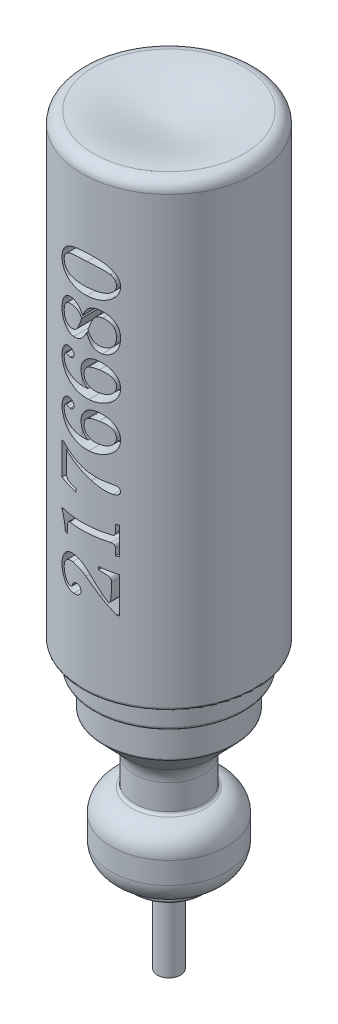
from build123d import *

# Parameters (mm, degrees)
SKETCH2_R          = 1.5
CUT_EXTRUDE1_DEPTH = 12
CUT_EXTRUDE2_DEPTH = 17


with BuildPart() as part:
    # Sketch1 → Revolve1 (revolve)
    with BuildSketch(Plane.XY):
        with BuildLine():
            Line((-15, -2), (-15, -78.95))
            ThreePointArc((-15, -78.95), (-14.853553391, -79.303553391), (-14.5, -79.45))
            Line((-14.5, -79.45), (-13.5, -79.45))
            ThreePointArc((-13.5, -79.45), (-13.146446609, -79.596446609), (-13, -79.95))
            Line((-13, -79.95), (-13, -83.248504981))
            ThreePointArc((-13, -83.248504981), (-12.853553391, -83.602058371), (-12.5, -83.748504981))
            Line((-12.5, -83.748504981), (-11.838067337, -83.748504981))
            ThreePointArc((-11.838067337, -83.748504981), (-11.484513946, -83.89495159), (-11.338067337, -84.248504981))
            Line((-11.338067337, -84.248504981), (-11.338067337, -89.200843352))
            ThreePointArc((-11.338067337, -89.200843352), (-11.329539781, -89.292793537), (-11.304247991, -89.38160728))
            Line((-11.304247991, -89.38160728), (-7.125848206, -93.698489625))
            ThreePointArc((-7.125848206, -93.698489625), (-6.292129508, -94.979875279), (-6, -96.480440643))
            Line((-6, -96.480440643), (-6, -100.813012654))
            ThreePointArc((-6, -100.813012654), (-6.127322004, -101.146345987), (-6.444444444, -101.309916649))
            ThreePointArc((-6.444444444, -101.309916649), (-8.98142397, -102.618481942), (-10, -105.285148609))
            Line((-10, -105.285148609), (-10, -109.057199722))
            ThreePointArc((-10, -109.057199722), (-8.925429803, -111.78517708), (-6.279069767, -113.047452855))
            ThreePointArc((-6.279069767, -113.047452855), (-6.080592765, -113.142123538), (-6, -113.34672184))
            Line((-6, -113.34672184), (-6, -114.253053973))
            ThreePointArc((-6, -114.253053973), (-5.912132034, -114.465186008), (-5.7, -114.553053973))
            Line((-5.7, -114.553053973), (-4, -114.553053973))
            ThreePointArc((-4, -114.553053973), (-2.585786438, -115.138840411), (-2, -116.553053973))
            Line((-2, -116.553053973), (-2, -128.553053973))
            Line((-2, -128.553053973), (0, -128.553053973))
            Line((0, -128.553053973), (0, -2))
            add(Edge.make_bspline(
                [(-13, 0), (-8.615684521, 0), (-5.475926009, -1.591368412), (0, -2)],
                knots=[0, 0, 0, 0, 1, 1, 1, 1], degree=3))
            ThreePointArc((-13, 0), (-14.414213562, -0.585786438), (-15, -2))
        make_face()
    revolve(axis=Axis((0, 0, 0), (0, -1, 0)))

    # Sketch2 → Cut-Extrude1 (cut)
    with BuildSketch(Plane(origin=(0, -128.553053973, 0), x_dir=(-1, 0, 0), z_dir=(0, -1, 0))):
        Circle(SKETCH2_R)
    extrude(amount=-CUT_EXTRUDE1_DEPTH, mode=Mode.SUBTRACT)

    # Sketch3 → Cut-Extrude2 (cut)
    # profile 1 of 7: a face of its own
    with BuildSketch(Plane.XY.offset(28.084540548)):
        with BuildLine():
            add(Edge.make_bspline(
                [(4.012275052, -64.439285096), (4.027570925, -64.449402774), (4.056027274, -64.46822564), (4.111563837, -64.463552169), (4.155281304, -64.421935656), (4.191774704, -64.356753871), (4.227737408, -64.265034063), (4.257767019, -64.143651596), (4.28793338, -63.994021196), (4.312480378, -63.815251868), (4.337267438, -63.608340074), (4.355852957, -63.372364936), (4.37457101, -63.107336018), (4.388121605, -62.813443848), (4.397351263, -62.490865696), (4.406076371, -62.139647537), (4.409247983, -61.759001657), (4.410344043, -61.495241123), (4.410912873, -61.358355609)],
                knots=[0, 0, 0, 0, 0.264522454, 0.492115977, 0.758469058, 1.116905389, 1.594696211, 2.206856012, 2.960861016, 3.847548454, 4.869807865, 6.037241621, 7.341541194, 8.792334255, 10.380264796, 12.105895113, 13.979051144, 16, 16, 16, 16], degree=3))
            add(Edge.make_bspline(
                [(4.410912873, -61.358355609), (4.407536595, -61.279311099), (4.401219546, -61.131418066), (4.353176689, -60.926011204), (4.265371743, -60.757206199), (4.158702197, -60.644311595), (4.046066527, -60.570403426), (3.929640244, -60.516219647), (3.785571421, -60.456005246), (3.610541877, -60.393922589), (3.404695577, -60.333468809), (3.168763866, -60.269396084), (2.903431422, -60.200644777), (2.715004696, -60.158523173), (2.616041078, -60.136400481)],
                knots=[0, 0, 0, 0, 1.181004775, 2.209671203, 3.12485452, 3.993073648, 4.496817558, 5.130576657, 5.908980013, 6.830669454, 7.904106987, 9.114595617, 10.484556503, 12, 12, 12, 12], degree=3))
            Line((2.616041078, -60.136400481), (2.616041078, -59.623579968))
            Line((2.616041078, -59.623579968), (5.436553898, -59.863964584))
            Line((5.436553898, -59.863964584), (5.436553898, -66.033836378))
            Line((5.436553898, -66.033836378), (5.089999411, -66.033836378))
            Line((5.089999411, -66.033836378), (2.856425693, -64.004589584))
            add(Edge.make_bspline(
                [(2.856425693, -64.004589584), (2.714937324, -63.87029897), (2.446338456, -63.615364188), (2.063553437, -63.254259749), (1.72219614, -62.935817451), (1.420088146, -62.661834286), (1.163659536, -62.425778824), (0.943658337, -62.236791775), (0.769724861, -62.084128105), (0.66260023, -62.002287756), (0.61684236, -61.967329968)],
                knots=[0, 0, 0, 0, 1.545890058, 2.934688704, 4.17028174, 5.24526459, 6.166829156, 6.931941195, 7.543782827, 8, 8, 8, 8], degree=3))
            add(Edge.make_bspline(
                [(0.61684236, -61.967329968), (0.509601135, -61.890499262), (0.301234745, -61.741219571), (-0.01769409, -61.54645817), (-0.331496341, -61.3844805), (-0.639571219, -61.256730589), (-0.937812972, -61.158317188), (-1.222967196, -61.087569923), (-1.494446189, -61.042662567), (-1.671330002, -61.036715317), (-1.756955717, -61.033836378)],
                knots=[0, 0, 0, 0, 1.221342228, 2.373030247, 3.457097868, 4.48831189, 5.458191672, 6.362523757, 7.207332364, 8, 8, 8, 8], degree=3))
            add(Edge.make_bspline(
                [(-1.756955717, -61.033836378), (-1.82444218, -61.035644607), (-1.955706719, -61.0391617), (-2.147497713, -61.05868324), (-2.328269631, -61.09395155), (-2.497048024, -61.147650494), (-2.656799828, -61.21009949), (-2.803673067, -61.291879334), (-2.940568281, -61.385659523), (-3.065475101, -61.494676852), (-3.177006903, -61.616227469), (-3.274854171, -61.749414063), (-3.353841749, -61.8954215), (-3.423588378, -62.049918173), (-3.475401879, -62.217481251), (-3.510426031, -62.396176839), (-3.533164571, -62.585742824), (-3.536229705, -62.715793149), (-3.537805076, -62.782634455)],
                knots=[0, 0, 0, 0, 1.144458313, 2.226028525, 3.265224511, 4.260822943, 5.225886888, 6.168369967, 7.104301311, 8.035219743, 8.972793312, 9.896800599, 10.829370084, 11.782403676, 12.767191675, 13.795287537, 14.866855124, 16, 16, 16, 16], degree=3))
            add(Edge.make_bspline(
                [(-3.537805076, -62.782634455), (-3.537153037, -62.858169793), (-3.535874806, -63.00624613), (-3.511165482, -63.221940592), (-3.481844074, -63.428229049), (-3.43177894, -63.622382291), (-3.373976788, -63.808012996), (-3.295390881, -63.979812413), (-3.210499703, -64.14452535), (-3.108932266, -64.294596265), (-2.998475464, -64.428953542), (-2.88979471, -64.550456448), (-2.776515816, -64.652275226), (-2.660686823, -64.73343128), (-2.544857462, -64.800104452), (-2.426257483, -64.846799056), (-2.30496014, -64.873009304), (-2.223815576, -64.877678408), (-2.183638409, -64.879990225)],
                knots=[0, 0, 0, 0, 1.325942456, 2.599322467, 3.810399692, 4.982506719, 6.117580095, 7.22043751, 8.296137669, 9.369725283, 10.395602926, 11.350345251, 12.230945344, 13.064096537, 13.830856947, 14.573645874, 15.293768247, 16, 16, 16, 16], degree=3))
            add(Edge.make_bspline(
                [(-2.183638409, -64.879990225), (-2.133270986, -64.878119323), (-2.041272429, -64.874702029), (-1.965515875, -64.823177754), (-1.931234563, -64.799862019)],
                knots=[0, 0, 0, 0, 1.094961168, 2, 2, 2, 2], degree=3))
            add(Edge.make_bspline(
                [(-1.931234563, -64.799862019), (-1.916527465, -64.784352716), (-1.883229775, -64.749238788), (-1.845176649, -64.677284016), (-1.809554861, -64.585447304), (-1.788520209, -64.516919949), (-1.776987768, -64.479349199)],
                knots=[0, 0, 0, 0, 0.710690112, 1.609041988, 2.689135369, 4, 4, 4, 4], degree=3))
            add(Edge.make_bspline(
                [(-1.776987768, -64.479349199), (-1.76309423, -64.430088211), (-1.736291928, -64.335057855), (-1.674081365, -64.206364611), (-1.596534231, -64.0968405), (-1.503739354, -64.008174739), (-1.396525414, -63.938164076), (-1.275281532, -63.887474524), (-1.137837547, -63.860039999), (-1.041929214, -63.856304393), (-0.991731358, -63.854349199)],
                knots=[0, 0, 0, 0, 1.118841646, 2.158379759, 3.111706183, 4.042232496, 4.950445241, 5.900628329, 6.901201232, 8, 8, 8, 8], degree=3))
            add(Edge.make_bspline(
                [(-0.991731358, -63.854349199), (-0.937312151, -63.856788057), (-0.831405389, -63.861534389), (-0.680783163, -63.905992689), (-0.542575809, -63.97370669), (-0.426023596, -64.07394894), (-0.325612078, -64.191302102), (-0.255702225, -64.330213888), (-0.21160543, -64.48402796), (-0.20690226, -64.591881538), (-0.204471743, -64.64761843)],
                knots=[0, 0, 0, 0, 1.041658564, 2.02720126, 2.989825143, 3.972448695, 4.955072247, 5.934935497, 6.932809853, 8, 8, 8, 8], degree=3))
            add(Edge.make_bspline(
                [(-0.204471743, -64.64761843), (-0.209235613, -64.71235378), (-0.218800366, -64.842327409), (-0.293330186, -65.028929621), (-0.414571215, -65.201120646), (-0.578221458, -65.357019), (-0.778843416, -65.489376781), (-1.014463687, -65.581095001), (-1.275848652, -65.641109719), (-1.460790424, -65.646452259), (-1.556635204, -65.649220994)],
                knots=[0, 0, 0, 0, 0.832009653, 1.670483162, 2.54834122, 3.527553162, 4.565144606, 5.62233063, 6.767789471, 8, 8, 8, 8], degree=3))
            add(Edge.make_bspline(
                [(-1.556635204, -65.649220994), (-1.667128572, -65.64504904), (-1.885471449, -65.636804959), (-2.205262687, -65.569136172), (-2.507966241, -65.455048278), (-2.795417591, -65.300335292), (-3.061821176, -65.098555916), (-3.301206114, -64.848166207), (-3.516719493, -64.554360558), (-3.704008428, -64.221388714), (-3.8574367, -63.85856231), (-3.97013616, -63.477159089), (-4.038248064, -63.080879158), (-4.04646881, -62.812280257), (-4.050625589, -62.676464584)],
                knots=[0, 0, 0, 0, 0.920351443, 1.818680946, 2.709792191, 3.608811046, 4.530474131, 5.482977408, 6.485916793, 7.560064738, 8.659916092, 9.762341353, 10.868539243, 12, 12, 12, 12], degree=3))
            add(Edge.make_bspline(
                [(-4.050625589, -62.676464584), (-4.046605065, -62.541947686), (-4.038673863, -62.276589101), (-3.969132107, -61.887053942), (-3.862535929, -61.511535878), (-3.707752726, -61.157362274), (-3.519538451, -60.831466189), (-3.303912189, -60.54108852), (-3.056043464, -60.298225786), (-2.784430343, -60.097997117), (-2.491125237, -59.944246462), (-2.183351613, -59.832636696), (-1.862127934, -59.764167939), (-1.643103793, -59.755937636), (-1.532596743, -59.751785096)],
                knots=[0, 0, 0, 0, 1.125398848, 2.220050047, 3.302844793, 4.387096258, 5.446679886, 6.448527043, 7.405228046, 8.341154212, 9.26394752, 10.167643655, 11.07549783, 12, 12, 12, 12], degree=3))
            add(Edge.make_bspline(
                [(-1.532596743, -59.751785096), (-1.454384005, -59.754499778), (-1.296672679, -59.759973773), (-1.059615858, -59.792103676), (-0.821983493, -59.849432536), (-0.584433056, -59.927773085), (-0.348769818, -60.025003705), (-0.118934933, -60.144275983), (0.103005668, -60.283572508), (0.242400599, -60.39098813), (0.31235518, -60.444894071)],
                knots=[0, 0, 0, 0, 0.935079848, 1.885532828, 2.853519397, 3.853043441, 4.872853088, 5.897399395, 6.944821426, 8, 8, 8, 8], degree=3))
            add(Edge.make_bspline(
                [(0.31235518, -60.444894071), (0.429592312, -60.54184648), (0.659358005, -60.731857417), (0.980445438, -61.032644881), (1.277482345, -61.335386603), (1.459229319, -61.545708005), (1.548332745, -61.648820353)],
                knots=[0, 0, 0, 0, 1.056246566, 2.070071318, 3.053831537, 4, 4, 4, 4], degree=3))
            Line((1.548332745, -61.648820353), (3.04673018, -63.445695353))
            add(Edge.make_bspline(
                [(3.04673018, -63.445695353), (3.136750787, -63.551896236), (3.306828424, -63.752543576), (3.558152222, -64.024435849), (3.788108509, -64.252188782), (3.941353667, -64.38009192), (4.012275052, -64.439285096)],
                knots=[0, 0, 0, 0, 1.203835763, 2.274429704, 3.201411408, 4, 4, 4, 4], degree=3))
        make_face()
    # profile 2 of 7: a face of its own
    with BuildSketch(Plane.XY.offset(28.084540548)):
        with BuildLine():
            Line((-4.050625589, -54.238964584), (4.485031463, -54.238964584))
            add(Edge.make_bspline(
                [(4.485031463, -54.238964584), (4.515299452, -54.23762475), (4.573546643, -54.235046398), (4.654350966, -54.209899518), (4.7268282, -54.172368929), (4.761847982, -54.132740611), (4.779502616, -54.11276266)],
                knots=[0, 0, 0, 0, 1.091998458, 2.101422775, 3.042864219, 4, 4, 4, 4], degree=3))
            add(Edge.make_bspline(
                [(4.779502616, -54.11276266), (4.802340249, -54.081540527), (4.847895106, -54.019260873), (4.890659574, -53.909049942), (4.920515814, -53.791196681), (4.92264658, -53.70831965), (4.923733386, -53.666047917)],
                knots=[0, 0, 0, 0, 0.966155666, 1.927217458, 2.942769681, 4, 4, 4, 4], degree=3))
            Line((4.923733386, -53.666047917), (4.923733386, -52.444092789))
            Line((4.923733386, -52.444092789), (5.436553898, -52.444092789))
            Line((5.436553898, -52.444092789), (5.436553898, -57.187682532))
            Line((5.436553898, -57.187682532), (4.923733386, -57.187682532))
            Line((4.923733386, -57.187682532), (4.923733386, -56.075903686))
            add(Edge.make_bspline(
                [(4.923733386, -56.075903686), (4.92225437, -56.021621282), (4.919466721, -55.919309753), (4.8872702, -55.776571171), (4.834193156, -55.65463421), (4.754826373, -55.558957775), (4.661845701, -55.482967958), (4.551940077, -55.430367063), (4.428185008, -55.397380472), (4.340355106, -55.39437309), (4.294726975, -55.392810737)],
                knots=[0, 0, 0, 0, 1.230543622, 2.319329815, 3.303175984, 4.21963065, 5.114763596, 6.009896541, 6.966130023, 8, 8, 8, 8], degree=3))
            Line((4.294726975, -55.392810737), (-2.287805076, -55.392810737))
            add(Edge.make_bspline(
                [(-2.287805076, -55.392810737), (-2.320722749, -55.394759542), (-2.3844991, -55.398535252), (-2.47700585, -55.427738579), (-2.559232212, -55.479538614), (-2.633110148, -55.547053573), (-2.693712853, -55.630145027), (-2.738034493, -55.725253773), (-2.765008093, -55.832051422), (-2.767353818, -55.906802231), (-2.768574307, -55.945695353)],
                knots=[0, 0, 0, 0, 0.965456179, 1.870523259, 2.811798899, 3.796757234, 4.792577982, 5.809775624, 6.860418164, 8, 8, 8, 8], degree=3))
            Line((-2.768574307, -55.945695353), (-2.768574307, -57.444092789))
            Line((-2.768574307, -57.444092789), (-3.28139482, -57.444092789))
            add(Edge.make_bspline(
                [(-3.28139482, -57.444092789), (-3.299592202, -57.275679367), (-3.334326796, -56.954217094), (-3.401994502, -56.498410872), (-3.478774544, -56.092345633), (-3.568341042, -55.732255233), (-3.667138724, -55.406252802), (-3.780138498, -55.104842548), (-3.903999872, -54.821728769), (-4.002487854, -54.645575444), (-4.050625589, -54.559477404)],
                knots=[0, 0, 0, 0, 1.351220085, 2.579166639, 3.675057167, 4.646601121, 5.537965881, 6.390857449, 7.213503243, 8, 8, 8, 8], degree=3))
            Line((-4.050625589, -54.559477404), (-4.050625589, -54.238964584))
        make_face()
    # profile 3 of 7: a face of its own
    with BuildSketch(Plane.XY.offset(28.084540548)):
        with BuildLine():
            add(Edge.make_bspline(
                [(-4.050625589, -49.751785096), (-4.050625589, -49.521416507), (-4.050625589, -49.043318216), (-4.050625589, -48.565219925), (-4.050625589, -48.317490225)],
                knots=[0, 0, 0, 0, 0.963687151, 2, 2, 2, 2], degree=3))
            Line((-4.050625589, -48.317490225), (-4.050625589, -44.110759455))
            Line((-4.050625589, -44.110759455), (-3.738125589, -44.110759455))
            add(Edge.make_bspline(
                [(-3.738125589, -44.110759455), (-3.603984731, -44.187009043), (-3.342248579, -44.335787528), (-2.957473025, -44.551663442), (-2.586645697, -44.749070504), (-2.233128765, -44.933499416), (-1.895286821, -45.102635755), (-1.573162073, -45.256409699), (-1.267237158, -45.397388525), (-0.88301847, -45.561274042), (-0.417643172, -45.742137924), (0.128996677, -45.935022341), (0.664326902, -46.098209719), (1.196040999, -46.235340378), (1.744054038, -46.347796207), (2.326158886, -46.43324348), (2.949307385, -46.505352032), (3.379759261, -46.532608608), (3.601618001, -46.546656891)],
                knots=[0, 0, 0, 0, 0.947153305, 1.848089124, 2.708124796, 3.52577056, 4.295656057, 5.027159827, 5.716802481, 6.363187097, 7.590941, 8.780963107, 9.920686199, 11.025171827, 12.150572577, 13.352842426, 14.635631354, 16, 16, 16, 16], degree=3))
            add(Edge.make_bspline(
                [(3.601618001, -46.546656891), (3.691770658, -46.551863461), (3.862761409, -46.561738659), (4.105815902, -46.577860049), (4.321531736, -46.593564699), (4.510489383, -46.609752823), (4.672214323, -46.624905279), (4.806849702, -46.642199433), (4.914975489, -46.653876523), (5.020155825, -46.67561991), (5.128866133, -46.704613913), (5.242357509, -46.756855858), (5.340558978, -46.825760281), (5.421514783, -46.911369856), (5.486070803, -47.010357313), (5.533793782, -47.123328348), (5.558306358, -47.250748663), (5.562556632, -47.339836531), (5.564759027, -47.38599984)],
                knots=[0, 0, 0, 0, 1.80468871, 3.422917174, 4.868088381, 6.127020532, 7.213196683, 8.113639518, 8.840280135, 9.384637349, 10.258992284, 11.082909861, 11.867865964, 12.641855903, 13.422831762, 14.218379112, 15.076804522, 16, 16, 16, 16], degree=3))
            add(Edge.make_bspline(
                [(5.564759027, -47.38599984), (5.562626547, -47.438479337), (5.558547929, -47.538852559), (5.511640695, -47.679736481), (5.438527984, -47.803467744), (5.333459571, -47.907848529), (5.196013996, -47.98931307), (5.026336517, -48.046331866), (4.824133456, -48.078790445), (4.678800085, -48.082916066), (4.60121736, -48.08511843)],
                knots=[0, 0, 0, 0, 0.928757684, 1.77635853, 2.606183773, 3.461548056, 4.376805525, 5.419496668, 6.622460364, 8, 8, 8, 8], degree=3))
            add(Edge.make_bspline(
                [(4.60121736, -48.08511843), (4.523033319, -48.082763659), (4.356227798, -48.07773976), (4.092579297, -48.048421359), (3.800760308, -47.998672843), (3.537986106, -47.944636909), (3.307405044, -47.882961079), (3.109539171, -47.828326433), (2.892139292, -47.756846688), (2.654561327, -47.671714078), (2.394732486, -47.578886913), (2.115001107, -47.471776398), (1.815392123, -47.351665333), (1.609005695, -47.266029414), (1.502259027, -47.221737019)],
                knots=[0, 0, 0, 0, 0.869827789, 1.855776124, 2.947437975, 4.16239747, 4.837986701, 5.602168407, 6.445427082, 7.382753648, 8.40951659, 9.514464775, 10.714437733, 12, 12, 12, 12], degree=3))
            add(Edge.make_bspline(
                [(1.502259027, -47.221737019), (1.357882604, -47.161986249), (1.077238642, -47.045840602), (0.66970255, -46.870463091), (0.285379116, -46.703008886), (-0.075592119, -46.540100754), (-0.413456004, -46.385192136), (-0.726787452, -46.233827003), (-1.017187437, -46.090711346), (-1.201579418, -45.994124034), (-1.290208922, -45.947698558)],
                knots=[0, 0, 0, 0, 1.221323737, 2.374051984, 3.467872604, 4.498092631, 5.469575672, 6.373002728, 7.217970541, 8, 8, 8, 8], degree=3))
            Line((-1.290208922, -45.947698558), (-3.024984563, -45.018211378))
            Line((-3.024984563, -45.018211378), (-3.024984563, -48.672057532))
            add(Edge.make_bspline(
                [(-3.024984563, -48.672057532), (-3.021693391, -48.735862721), (-3.015478534, -48.856348684), (-2.964091757, -49.025996755), (-2.876548743, -49.169265347), (-2.771212315, -49.26913126), (-2.655566186, -49.333531841), (-2.534884958, -49.386879611), (-2.379411608, -49.442430689), (-2.189866945, -49.499142723), (-1.966204644, -49.559757368), (-1.70849137, -49.620117531), (-1.417114652, -49.687570707), (-1.210859113, -49.729589358), (-1.10190764, -49.751785096)],
                knots=[0, 0, 0, 0, 0.951014373, 1.795839581, 2.614573855, 3.432519222, 3.928224, 4.583941917, 5.400489657, 6.39039533, 7.536318261, 8.858539916, 10.340569627, 12, 12, 12, 12], degree=3))
            Line((-1.10190764, -49.751785096), (-1.10190764, -50.264605609))
            Line((-1.10190764, -50.264605609), (-4.050625589, -49.751785096))
        make_face()
    # profile 4 of 7: a face of its own
    with BuildSketch(Plane.XY.offset(28.084540548)):
        with BuildLine():
            add(Edge.make_bspline(
                [(0.955384027, -41.418451763), (0.857291868, -41.334336714), (0.667628078, -41.171698036), (0.423964571, -40.902785561), (0.216819804, -40.632806086), (0.059646402, -40.349599032), (-0.06121418, -40.057966185), (-0.141094702, -39.752374058), (-0.196968784, -39.434648479), (-0.201944912, -39.217180995), (-0.204471743, -39.106753045)],
                knots=[0, 0, 0, 0, 1.154902062, 2.233033763, 3.240199197, 4.19234298, 5.121957947, 6.056645336, 7.013182717, 8, 8, 8, 8], degree=3))
            add(Edge.make_bspline(
                [(-0.204471743, -39.106753045), (-0.202035846, -39.01784451), (-0.197237445, -38.842706209), (-0.163120231, -38.585542316), (-0.104615575, -38.340165096), (-0.024362616, -38.105564192), (0.080553665, -37.88200006), (0.209208286, -37.66948897), (0.360261828, -37.468230475), (0.53234734, -37.280770545), (0.721391714, -37.108773232), (0.925662672, -36.958689484), (1.142322237, -36.830889803), (1.370591928, -36.726778996), (1.61174009, -36.64617878), (1.8645531, -36.588071245), (2.130326213, -36.553794213), (2.311454307, -36.549065291), (2.403701334, -36.546656891)],
                knots=[0, 0, 0, 0, 1.044483906, 2.057498042, 3.041291563, 4.003930521, 4.965577941, 5.937000168, 6.91766058, 7.91718785, 8.922517361, 9.915774843, 10.889917702, 11.872928882, 12.857847881, 13.872197807, 14.916328091, 16, 16, 16, 16], degree=3))
            add(Edge.make_bspline(
                [(2.403701334, -36.546656891), (2.514682404, -36.549247878), (2.732792559, -36.554339924), (3.052743959, -36.597532397), (3.358698126, -36.667381056), (3.650385781, -36.765257758), (3.926114818, -36.893085392), (4.189131072, -37.045437167), (4.435839234, -37.229470135), (4.666617981, -37.438111091), (4.875185929, -37.667889726), (5.061981045, -37.909975193), (5.216164973, -38.169168933), (5.345651161, -38.439407201), (5.444019998, -38.724565374), (5.513895483, -39.02254087), (5.556990177, -39.333858853), (5.562143791, -39.54598382), (5.564759027, -39.653628045)],
                knots=[0, 0, 0, 0, 1.075461414, 2.113595198, 3.12322715, 4.11394509, 5.090006378, 6.064736038, 7.055115589, 8.067896563, 9.075887968, 10.059794727, 11.02669112, 11.993760831, 12.959985324, 13.94440296, 14.956873611, 16, 16, 16, 16], degree=3))
            add(Edge.make_bspline(
                [(5.564759027, -39.653628045), (5.563044639, -39.729795639), (5.559638877, -39.881108356), (5.537779657, -40.10483831), (5.499574458, -40.322472923), (5.445476722, -40.533511604), (5.375147706, -40.737529223), (5.290388052, -40.935864505), (5.190279807, -41.1271541), (5.076342695, -41.313335889), (4.942428092, -41.489446429), (4.795038681, -41.65993012), (4.629139856, -41.821760005), (4.444446544, -41.972958815), (4.24358887, -42.117217854), (4.02694634, -42.254467105), (3.790750981, -42.379615079), (3.54080438, -42.499567193), (3.276104784, -42.607708321), (2.999466399, -42.70240447), (2.711305464, -42.779377623), (2.412387849, -42.843673202), (2.103757053, -42.896000386), (1.783439962, -42.932088175), (1.452419601, -42.951402976), (1.227843093, -42.955055733), (1.113637232, -42.956913302)],
                knots=[0, 0, 0, 0, 0.883685917, 1.755509281, 2.60501919, 3.44490211, 4.280307152, 5.106284122, 5.944808297, 6.783225109, 7.635380099, 8.508441654, 9.395922559, 10.320367182, 11.27496185, 12.263651042, 13.293080668, 14.374205368, 15.479050434, 16.608419863, 17.764157401, 18.93718706, 20.154726882, 21.394346088, 22.674923956, 24, 24, 24, 24], degree=3))
            add(Edge.make_bspline(
                [(1.113637232, -42.956913302), (0.990043038, -42.955775257), (0.745194116, -42.953520711), (0.382980666, -42.923394568), (0.029123491, -42.880423645), (-0.3159355, -42.818018711), (-0.652465557, -42.73829117), (-0.980135671, -42.639687465), (-1.299180811, -42.523342318), (-1.607558485, -42.390253991), (-1.901197282, -42.24191177), (-2.178381668, -42.083953518), (-2.436276006, -41.915698837), (-2.676922529, -41.739925013), (-2.894556924, -41.550282453), (-3.097090172, -41.353927375), (-3.278520674, -41.145678786), (-3.4419905, -40.929200053), (-3.58215657, -40.705015694), (-3.708108049, -40.479742236), (-3.814896981, -40.251140081), (-3.900784784, -40.019166991), (-3.967069928, -39.785274685), (-4.016048349, -39.549797894), (-4.044277273, -39.311102469), (-4.048507818, -39.150894143), (-4.050625589, -39.070695353)],
                knots=[0, 0, 0, 0, 1.243143806, 2.462756642, 3.654348452, 4.828483941, 5.988679225, 7.132142967, 8.269174644, 9.40360339, 10.509240407, 11.577506956, 12.611683861, 13.605989218, 14.572956063, 15.513589683, 16.441980262, 17.348927284, 18.239807545, 19.099832649, 19.94442161, 20.775543684, 21.585767516, 22.388154802, 23.193125368, 24, 24, 24, 24], degree=3))
            add(Edge.make_bspline(
                [(-4.050625589, -39.070695353), (-4.04935796, -38.989148388), (-4.04686783, -38.82895754), (-4.019151669, -38.5934099), (-3.978652412, -38.36725582), (-3.917759772, -38.150790302), (-3.839026351, -37.94411597), (-3.74550704, -37.746010917), (-3.634731556, -37.557105934), (-3.547621121, -37.4406453), (-3.503750589, -37.38199343)],
                knots=[0, 0, 0, 0, 1.081133678, 2.12377886, 3.141755168, 4.125997766, 5.101473931, 6.072112995, 7.02907811, 8, 8, 8, 8], degree=3))
            add(Edge.make_bspline(
                [(-3.503750589, -37.38199343), (-3.466739819, -37.335639509), (-3.394920383, -37.24568968), (-3.272527311, -37.129791997), (-3.148578519, -37.02805553), (-3.017975778, -36.944620644), (-2.87969083, -36.882976767), (-2.737179038, -36.835304765), (-2.587842275, -36.809888931), (-2.486871631, -36.805351383), (-2.436042255, -36.803067148)],
                knots=[0, 0, 0, 0, 1.127905394, 2.18870153, 3.201176125, 4.178074235, 5.128053522, 6.076756242, 7.031824741, 8, 8, 8, 8], degree=3))
            add(Edge.make_bspline(
                [(-2.436042255, -36.803067148), (-2.369651375, -36.805339722), (-2.241282837, -36.809733804), (-2.058293947, -36.855534202), (-1.89335545, -36.927459398), (-1.750618264, -37.028037058), (-1.634672076, -37.149670138), (-1.547885842, -37.285886927), (-1.494589871, -37.436962961), (-1.48924855, -37.542489284), (-1.486523025, -37.596336378)],
                knots=[0, 0, 0, 0, 1.153726211, 2.230760421, 3.261177434, 4.270660677, 5.249146575, 6.168386457, 7.065379467, 8, 8, 8, 8], degree=3))
            add(Edge.make_bspline(
                [(-1.486523025, -37.596336378), (-1.489109143, -37.646062894), (-1.494204648, -37.744040492), (-1.538092876, -37.884773307), (-1.609564322, -38.013796572), (-1.708367818, -38.125892342), (-1.822137741, -38.222061263), (-1.951409366, -38.292252753), (-2.0917139, -38.333123627), (-2.188721662, -38.338707835), (-2.237724948, -38.341528686)],
                knots=[0, 0, 0, 0, 1.015196891, 2.000271924, 2.984589206, 4.011205994, 5.0394568, 6.017214113, 6.99839949, 8, 8, 8, 8], degree=3))
            add(Edge.make_bspline(
                [(-2.237724948, -38.341528686), (-2.31013673, -38.338320504), (-2.465818627, -38.331423063), (-2.617390406, -38.294937875), (-2.698462127, -38.275422917)],
                knots=[0, 0, 0, 0, 0.93025309, 2, 2, 2, 2], degree=3))
            add(Edge.make_bspline(
                [(-2.698462127, -38.275422917), (-2.735723121, -38.265462905), (-2.805143136, -38.24690666), (-2.905172975, -38.229688326), (-2.991908128, -38.216178713), (-3.046311835, -38.214216228), (-3.071058281, -38.213323558)],
                knots=[0, 0, 0, 0, 1.221632649, 2.275992896, 3.215806202, 4, 4, 4, 4], degree=3))
            add(Edge.make_bspline(
                [(-3.071058281, -38.213323558), (-3.101490295, -38.2148212), (-3.161754619, -38.21778697), (-3.24548095, -38.254770874), (-3.321574412, -38.311147276), (-3.360734459, -38.362370985), (-3.381555076, -38.389605609)],
                knots=[0, 0, 0, 0, 0.975009045, 1.930804205, 2.899849836, 4, 4, 4, 4], degree=3))
            add(Edge.make_bspline(
                [(-3.381555076, -38.389605609), (-3.405964794, -38.431573939), (-3.456898037, -38.519144932), (-3.502259548, -38.673702886), (-3.532992796, -38.847751998), (-3.536150765, -38.971706811), (-3.537805076, -39.036640866)],
                knots=[0, 0, 0, 0, 0.861132824, 1.796837179, 2.845867366, 4, 4, 4, 4], degree=3))
            add(Edge.make_bspline(
                [(-3.537805076, -39.036640866), (-3.533747014, -39.140669997), (-3.525725688, -39.34629811), (-3.444093787, -39.645665721), (-3.319458382, -39.931569957), (-3.173364911, -40.154699308), (-3.031571655, -40.325539906), (-2.901494966, -40.446185974), (-2.75728583, -40.566282072), (-2.591921068, -40.67664953), (-2.411071721, -40.785530612), (-2.212615696, -40.889628291), (-1.995757446, -40.987519607), (-1.680146572, -41.111084958), (-1.258579848, -41.24406022), (-0.724070052, -41.357248348), (-0.159588071, -41.427132726), (0.226677, -41.434638904), (0.424534668, -41.438483814)],
                knots=[0, 0, 0, 0, 0.971587853, 1.920479144, 2.883101285, 3.881572642, 4.404900302, 4.95745184, 5.53920268, 6.159773275, 6.815714157, 7.514581237, 8.25575938, 9.041447137, 10.685960995, 12.386095444, 14.148839282, 16, 16, 16, 16], degree=3))
            add(Edge.make_bspline(
                [(0.424534668, -41.438483814), (0.457923825, -41.437910889), (0.531394208, -41.43665021), (0.652919265, -41.432284942), (0.796487652, -41.426344967), (0.89996568, -41.421204679), (0.955384027, -41.418451763)],
                knots=[0, 0, 0, 0, 0.754292582, 1.659765325, 2.74667174, 4, 4, 4, 4], degree=3))
        make_face()
        with BuildLine():
            add(Edge.make_bspline(
                [(0.30834877, -39.453307532), (0.310328133, -39.518856559), (0.314224517, -39.647890073), (0.343395876, -39.837064816), (0.387942189, -40.017788211), (0.455976975, -40.188800817), (0.541574895, -40.349834852), (0.645199921, -40.502731573), (0.768620915, -40.645388523), (0.909856976, -40.778732944), (1.068563874, -40.899719208), (1.244650651, -41.003625783), (1.434519268, -41.094360735), (1.640992072, -41.166171208), (1.861586738, -41.221902459), (2.097371473, -41.261645648), (2.348433161, -41.285986671), (2.52116561, -41.28879951), (2.610031463, -41.290246635)],
                knots=[0, 0, 0, 0, 0.948882356, 1.867878613, 2.766138513, 3.638843228, 4.525631163, 5.402664559, 6.307820492, 7.251812306, 8.211083479, 9.191183553, 10.2076731, 11.253632215, 12.351239893, 13.499028375, 14.71332239, 16, 16, 16, 16], degree=3))
            add(Edge.make_bspline(
                [(2.610031463, -41.290246635), (2.706245663, -41.288859533), (2.892981406, -41.286167398), (3.163830654, -41.261128135), (3.41771934, -41.224124175), (3.654331861, -41.170400697), (3.873822809, -41.10071252), (4.074797509, -41.014227018), (4.259170261, -40.913758995), (4.425059433, -40.798103319), (4.571944471, -40.668892095), (4.70060829, -40.530954772), (4.80976692, -40.383927944), (4.898593891, -40.228636104), (4.967920735, -40.064652585), (5.014827468, -39.891357333), (5.046591395, -39.710205562), (5.050137703, -39.58632575), (5.051938514, -39.523419712)],
                knots=[0, 0, 0, 0, 1.364103527, 2.647497837, 3.854117083, 5.000370457, 6.084428247, 7.115189779, 8.098401111, 9.057233799, 9.976535432, 10.867705672, 11.727535847, 12.567318146, 13.399161598, 14.244637041, 15.108628548, 16, 16, 16, 16], degree=3))
            add(Edge.make_bspline(
                [(5.051938514, -39.523419712), (5.049972915, -39.461207959), (5.04612672, -39.339474828), (5.017133007, -39.161474149), (4.971361683, -38.9927377), (4.907388178, -38.832625515), (4.821546554, -38.68355376), (4.719279604, -38.542755629), (4.59797669, -38.411199931), (4.456555972, -38.291567472), (4.299330367, -38.181010409), (4.122295025, -38.086149759), (3.927339576, -38.006761653), (3.714394472, -37.94031076), (3.482235719, -37.891047304), (3.232566437, -37.855775451), (2.964335574, -37.833294255), (2.779682587, -37.830271852), (2.684150052, -37.828708173)],
                knots=[0, 0, 0, 0, 0.909464863, 1.77959952, 2.630059748, 3.462386829, 4.293280591, 5.139018502, 6.002828823, 6.903125566, 7.843113683, 8.808722522, 9.833312613, 10.91741345, 12.066627965, 13.299854739, 14.603046049, 16, 16, 16, 16], degree=3))
            add(Edge.make_bspline(
                [(2.684150052, -37.828708173), (2.583283371, -37.829604519), (2.388678147, -37.831333866), (2.107138426, -37.851762961), (1.847310342, -37.88442581), (1.609303673, -37.933288053), (1.392229178, -37.991826452), (1.196338395, -38.066362028), (1.021677764, -38.153260438), (0.869357891, -38.255491871), (0.735417268, -38.36706623), (0.623345041, -38.494087387), (0.524064231, -38.62669305), (0.444907313, -38.772644626), (0.38235948, -38.927697887), (0.342205802, -39.094615619), (0.311245217, -39.269876594), (0.309331735, -39.391056724), (0.30834877, -39.453307532)],
                knots=[0, 0, 0, 0, 1.482183738, 2.85962318, 4.146285869, 5.32802986, 6.428056911, 7.446902786, 8.403690218, 9.288298673, 10.137749583, 10.957661338, 11.772269979, 12.56725238, 13.390972928, 14.221679218, 15.086468168, 16, 16, 16, 16], degree=3))
        make_face(mode=Mode.SUBTRACT)
    # profile 5 of 7: a face of its own
    with BuildSketch(Plane.XY.offset(28.084540548)):
        with BuildLine():
            add(Edge.make_bspline(
                [(0.955384027, -33.726144071), (0.857291868, -33.642029022), (0.667628078, -33.479390344), (0.423964571, -33.210477869), (0.216819804, -32.940498393), (0.059646402, -32.65729134), (-0.06121418, -32.365658493), (-0.141094702, -32.060066366), (-0.196968784, -31.742340787), (-0.201944912, -31.524873303), (-0.204471743, -31.414445353)],
                knots=[0, 0, 0, 0, 1.154902062, 2.233033763, 3.240199197, 4.19234298, 5.121957947, 6.056645336, 7.013182717, 8, 8, 8, 8], degree=3))
            add(Edge.make_bspline(
                [(-0.204471743, -31.414445353), (-0.202035846, -31.325536818), (-0.197237445, -31.150398517), (-0.163120231, -30.893234624), (-0.104615575, -30.647857404), (-0.024362616, -30.4132565), (0.080553665, -30.189692368), (0.209208286, -29.977181278), (0.360261828, -29.775922783), (0.53234734, -29.588462853), (0.721391714, -29.41646554), (0.925662672, -29.266381792), (1.142322237, -29.13858211), (1.370591928, -29.034471303), (1.61174009, -28.953871088), (1.8645531, -28.895763552), (2.130326213, -28.86148652), (2.311454307, -28.856757599), (2.403701334, -28.854349199)],
                knots=[0, 0, 0, 0, 1.044483906, 2.057498042, 3.041291563, 4.003930521, 4.965577941, 5.937000168, 6.91766058, 7.91718785, 8.922517361, 9.915774843, 10.889917702, 11.872928882, 12.857847881, 13.872197807, 14.916328091, 16, 16, 16, 16], degree=3))
            add(Edge.make_bspline(
                [(2.403701334, -28.854349199), (2.514682404, -28.856940186), (2.732792559, -28.862032231), (3.052743959, -28.905224705), (3.358698126, -28.975073363), (3.650385781, -29.072950066), (3.926114818, -29.2007777), (4.189131072, -29.353129475), (4.435839234, -29.537162442), (4.666617981, -29.745803398), (4.875185929, -29.975582034), (5.061981045, -30.217667501), (5.216164973, -30.476861241), (5.345651161, -30.747099509), (5.444019998, -31.032257682), (5.513895483, -31.330233178), (5.556990177, -31.64155116), (5.562143791, -31.853676128), (5.564759027, -31.961320353)],
                knots=[0, 0, 0, 0, 1.075461414, 2.113595198, 3.12322715, 4.11394509, 5.090006378, 6.064736038, 7.055115589, 8.067896563, 9.075887968, 10.059794727, 11.02669112, 11.993760831, 12.959985324, 13.94440296, 14.956873611, 16, 16, 16, 16], degree=3))
            add(Edge.make_bspline(
                [(5.564759027, -31.961320353), (5.563044639, -32.037487946), (5.559638877, -32.188800664), (5.537779657, -32.412530617), (5.499574458, -32.630165231), (5.445476722, -32.841203912), (5.375147706, -33.045221531), (5.290388052, -33.243556812), (5.190279807, -33.434846408), (5.076342695, -33.621028197), (4.942428092, -33.797138737), (4.795038681, -33.967622428), (4.629139856, -34.129452312), (4.444446544, -34.280651123), (4.24358887, -34.424910161), (4.02694634, -34.562159413), (3.790750981, -34.687307387), (3.54080438, -34.807259501), (3.276104784, -34.915400629), (2.999466399, -35.010096778), (2.711305464, -35.087069931), (2.412387849, -35.15136551), (2.103757053, -35.203692693), (1.783439962, -35.239780482), (1.452419601, -35.259095283), (1.227843093, -35.262748041), (1.113637232, -35.264605609)],
                knots=[0, 0, 0, 0, 0.883685917, 1.755509281, 2.60501919, 3.44490211, 4.280307152, 5.106284122, 5.944808297, 6.783225109, 7.635380099, 8.508441654, 9.395922559, 10.320367182, 11.27496185, 12.263651042, 13.293080668, 14.374205368, 15.479050434, 16.608419863, 17.764157401, 18.93718706, 20.154726882, 21.394346088, 22.674923956, 24, 24, 24, 24], degree=3))
            add(Edge.make_bspline(
                [(1.113637232, -35.264605609), (0.990043038, -35.263467565), (0.745194116, -35.261213018), (0.382980666, -35.231086876), (0.029123491, -35.188115952), (-0.3159355, -35.125711018), (-0.652465557, -35.045983478), (-0.980135671, -34.947379773), (-1.299180811, -34.831034626), (-1.607558485, -34.697946299), (-1.901197282, -34.549604077), (-2.178381668, -34.391645826), (-2.436276006, -34.223391145), (-2.676922529, -34.047617321), (-2.894556924, -33.857974761), (-3.097090172, -33.661619683), (-3.278520674, -33.453371094), (-3.4419905, -33.23689236), (-3.58215657, -33.012708002), (-3.708108049, -32.787434544), (-3.814896981, -32.558832389), (-3.900784784, -32.326859299), (-3.967069928, -32.092966993), (-4.016048349, -31.857490202), (-4.044277273, -31.618794776), (-4.048507818, -31.45858645), (-4.050625589, -31.37838766)],
                knots=[0, 0, 0, 0, 1.243143806, 2.462756642, 3.654348452, 4.828483941, 5.988679225, 7.132142967, 8.269174644, 9.40360339, 10.509240407, 11.577506956, 12.611683861, 13.605989218, 14.572956063, 15.513589683, 16.441980262, 17.348927284, 18.239807545, 19.099832649, 19.94442161, 20.775543684, 21.585767516, 22.388154802, 23.193125368, 24, 24, 24, 24], degree=3))
            add(Edge.make_bspline(
                [(-4.050625589, -31.37838766), (-4.04935796, -31.296840695), (-4.04686783, -31.136649847), (-4.019151669, -30.901102207), (-3.978652412, -30.674948128), (-3.917759772, -30.45848261), (-3.839026351, -30.251808278), (-3.74550704, -30.053703224), (-3.634731556, -29.864798242), (-3.547621121, -29.748337608), (-3.503750589, -29.689685737)],
                knots=[0, 0, 0, 0, 1.081133678, 2.12377886, 3.141755168, 4.125997766, 5.101473931, 6.072112995, 7.02907811, 8, 8, 8, 8], degree=3))
            add(Edge.make_bspline(
                [(-3.503750589, -29.689685737), (-3.466739819, -29.643331817), (-3.394920383, -29.553381988), (-3.272527311, -29.437484304), (-3.148578519, -29.335747838), (-3.017975778, -29.252312951), (-2.87969083, -29.190669075), (-2.737179038, -29.142997073), (-2.587842275, -29.117581239), (-2.486871631, -29.113043691), (-2.436042255, -29.110759455)],
                knots=[0, 0, 0, 0, 1.127905394, 2.18870153, 3.201176125, 4.178074235, 5.128053522, 6.076756242, 7.031824741, 8, 8, 8, 8], degree=3))
            add(Edge.make_bspline(
                [(-2.436042255, -29.110759455), (-2.369651375, -29.113032029), (-2.241282837, -29.117426112), (-2.058293947, -29.16322651), (-1.89335545, -29.235151706), (-1.750618264, -29.335729366), (-1.634672076, -29.457362446), (-1.547885842, -29.593579235), (-1.494589871, -29.744655269), (-1.48924855, -29.850181591), (-1.486523025, -29.904028686)],
                knots=[0, 0, 0, 0, 1.153726211, 2.230760421, 3.261177434, 4.270660677, 5.249146575, 6.168386457, 7.065379467, 8, 8, 8, 8], degree=3))
            add(Edge.make_bspline(
                [(-1.486523025, -29.904028686), (-1.489109143, -29.953755202), (-1.494204648, -30.0517328), (-1.538092876, -30.192465615), (-1.609564322, -30.32148888), (-1.708367818, -30.43358465), (-1.822137741, -30.529753571), (-1.951409366, -30.599945061), (-2.0917139, -30.640815935), (-2.188721662, -30.646400142), (-2.237724948, -30.649220994)],
                knots=[0, 0, 0, 0, 1.015196891, 2.000271924, 2.984589206, 4.011205994, 5.0394568, 6.017214113, 6.99839949, 8, 8, 8, 8], degree=3))
            add(Edge.make_bspline(
                [(-2.237724948, -30.649220994), (-2.31013673, -30.646012811), (-2.465818627, -30.639115371), (-2.617390406, -30.602630183), (-2.698462127, -30.583115225)],
                knots=[0, 0, 0, 0, 0.93025309, 2, 2, 2, 2], degree=3))
            add(Edge.make_bspline(
                [(-2.698462127, -30.583115225), (-2.735723121, -30.573155213), (-2.805143136, -30.554598967), (-2.905172975, -30.537380634), (-2.991908128, -30.523871021), (-3.046311835, -30.521908535), (-3.071058281, -30.521015866)],
                knots=[0, 0, 0, 0, 1.221632649, 2.275992896, 3.215806202, 4, 4, 4, 4], degree=3))
            add(Edge.make_bspline(
                [(-3.071058281, -30.521015866), (-3.101490295, -30.522513507), (-3.161754619, -30.525479277), (-3.24548095, -30.562463182), (-3.321574412, -30.618839584), (-3.360734459, -30.670063292), (-3.381555076, -30.697297917)],
                knots=[0, 0, 0, 0, 0.975009045, 1.930804205, 2.899849836, 4, 4, 4, 4], degree=3))
            add(Edge.make_bspline(
                [(-3.381555076, -30.697297917), (-3.405964794, -30.739266247), (-3.456898037, -30.82683724), (-3.502259548, -30.981395194), (-3.532992796, -31.155444306), (-3.536150765, -31.279399119), (-3.537805076, -31.344333173)],
                knots=[0, 0, 0, 0, 0.861132824, 1.796837179, 2.845867366, 4, 4, 4, 4], degree=3))
            add(Edge.make_bspline(
                [(-3.537805076, -31.344333173), (-3.533747014, -31.448362304), (-3.525725688, -31.653990417), (-3.444093787, -31.953358029), (-3.319458382, -32.239262265), (-3.173364911, -32.462391616), (-3.031571655, -32.633232213), (-2.901494966, -32.753878282), (-2.75728583, -32.87397438), (-2.591921068, -32.984341837), (-2.411071721, -33.093222919), (-2.212615696, -33.197320598), (-1.995757446, -33.295211914), (-1.680146572, -33.418777265), (-1.258579848, -33.551752528), (-0.724070052, -33.664940656), (-0.159588071, -33.734825034), (0.226677, -33.742331211), (0.424534668, -33.746176122)],
                knots=[0, 0, 0, 0, 0.971587853, 1.920479144, 2.883101285, 3.881572642, 4.404900302, 4.95745184, 5.53920268, 6.159773275, 6.815714157, 7.514581237, 8.25575938, 9.041447137, 10.685960995, 12.386095444, 14.148839282, 16, 16, 16, 16], degree=3))
            add(Edge.make_bspline(
                [(0.424534668, -33.746176122), (0.457923825, -33.745603197), (0.531394208, -33.744342518), (0.652919265, -33.73997725), (0.796487652, -33.734037274), (0.89996568, -33.728896986), (0.955384027, -33.726144071)],
                knots=[0, 0, 0, 0, 0.754292582, 1.659765325, 2.74667174, 4, 4, 4, 4], degree=3))
        make_face()
        with BuildLine():
            add(Edge.make_bspline(
                [(0.30834877, -31.76099984), (0.310328133, -31.826548866), (0.314224517, -31.95558238), (0.343395876, -32.144757124), (0.387942189, -32.325480519), (0.455976975, -32.496493125), (0.541574895, -32.65752716), (0.645199921, -32.810423881), (0.768620915, -32.953080831), (0.909856976, -33.086425252), (1.068563874, -33.207411516), (1.244650651, -33.311318091), (1.434519268, -33.402053043), (1.640992072, -33.473863515), (1.861586738, -33.529594767), (2.097371473, -33.569337956), (2.348433161, -33.593678979), (2.52116561, -33.596491818), (2.610031463, -33.597938943)],
                knots=[0, 0, 0, 0, 0.948882356, 1.867878613, 2.766138513, 3.638843228, 4.525631163, 5.402664559, 6.307820492, 7.251812306, 8.211083479, 9.191183553, 10.2076731, 11.253632215, 12.351239893, 13.499028375, 14.71332239, 16, 16, 16, 16], degree=3))
            add(Edge.make_bspline(
                [(2.610031463, -33.597938943), (2.706245663, -33.59655184), (2.892981406, -33.593859706), (3.163830654, -33.568820443), (3.41771934, -33.531816483), (3.654331861, -33.478093005), (3.873822809, -33.408404828), (4.074797509, -33.321919326), (4.259170261, -33.221451303), (4.425059433, -33.105795627), (4.571944471, -32.976584403), (4.70060829, -32.83864708), (4.80976692, -32.691620252), (4.898593891, -32.536328412), (4.967920735, -32.372344893), (5.014827468, -32.199049641), (5.046591395, -32.01789787), (5.050137703, -31.894018057), (5.051938514, -31.831112019)],
                knots=[0, 0, 0, 0, 1.364103527, 2.647497837, 3.854117083, 5.000370457, 6.084428247, 7.115189779, 8.098401111, 9.057233799, 9.976535432, 10.867705672, 11.727535847, 12.567318146, 13.399161598, 14.244637041, 15.108628548, 16, 16, 16, 16], degree=3))
            add(Edge.make_bspline(
                [(5.051938514, -31.831112019), (5.049972915, -31.768900267), (5.04612672, -31.647167136), (5.017133007, -31.469166457), (4.971361683, -31.300430008), (4.907388178, -31.140317823), (4.821546554, -30.991246068), (4.719279604, -30.850447936), (4.59797669, -30.718892239), (4.456555972, -30.59925978), (4.299330367, -30.488702717), (4.122295025, -30.393842067), (3.927339576, -30.31445396), (3.714394472, -30.248003068), (3.482235719, -30.198739612), (3.232566437, -30.163467759), (2.964335574, -30.140986563), (2.779682587, -30.137964159), (2.684150052, -30.136400481)],
                knots=[0, 0, 0, 0, 0.909464863, 1.77959952, 2.630059748, 3.462386829, 4.293280591, 5.139018502, 6.002828823, 6.903125566, 7.843113683, 8.808722522, 9.833312613, 10.91741345, 12.066627965, 13.299854739, 14.603046049, 16, 16, 16, 16], degree=3))
            add(Edge.make_bspline(
                [(2.684150052, -30.136400481), (2.583283371, -30.137296826), (2.388678147, -30.139026173), (2.107138426, -30.159455268), (1.847310342, -30.192118117), (1.609303673, -30.240980361), (1.392229178, -30.299518759), (1.196338395, -30.374054336), (1.021677764, -30.460952745), (0.869357891, -30.563184179), (0.735417268, -30.674758538), (0.623345041, -30.801779695), (0.524064231, -30.934385358), (0.444907313, -31.080336934), (0.38235948, -31.235390194), (0.342205802, -31.402307927), (0.311245217, -31.577568901), (0.309331735, -31.698749032), (0.30834877, -31.76099984)],
                knots=[0, 0, 0, 0, 1.482183738, 2.85962318, 4.146285869, 5.32802986, 6.428056911, 7.446902786, 8.403690218, 9.288298673, 10.137749583, 10.957661338, 11.772269979, 12.56725238, 13.390972928, 14.221679218, 15.086468168, 16, 16, 16, 16], degree=3))
        make_face(mode=Mode.SUBTRACT)
    # profile 6 of 7: a face of its own
    with BuildSketch(Plane.XY.offset(28.084540548)):
        with BuildLine():
            add(Edge.make_bspline(
                [(0.100015437, -23.165246635), (0.132151882, -23.07593122), (0.194762126, -22.90192131), (0.306496422, -22.657304574), (0.41921502, -22.429939385), (0.544512924, -22.226358767), (0.673884779, -22.039614514), (0.814288846, -21.87678406), (0.959187773, -21.731127496), (1.115337149, -21.609143555), (1.277507715, -21.50251016), (1.448306093, -21.411875848), (1.625248541, -21.333314384), (1.812170922, -21.271781681), (2.005825103, -21.220403479), (2.208622017, -21.188525398), (2.418466342, -21.164064091), (2.561208412, -21.162725023), (2.634069924, -21.162041507)],
                knots=[0, 0, 0, 0, 1.303387283, 2.539341093, 3.692126295, 4.787073119, 5.820381076, 6.809375575, 7.736947795, 8.638061784, 9.526006384, 10.400150248, 11.291499846, 12.182046661, 13.100914653, 14.040429871, 14.999753587, 16, 16, 16, 16], degree=3))
            add(Edge.make_bspline(
                [(2.634069924, -21.162041507), (2.72301159, -21.163500531), (2.898241934, -21.166375058), (3.156629072, -21.203214226), (3.407018302, -21.255782226), (3.648686137, -21.332117651), (3.880271743, -21.432264839), (4.105838529, -21.549198003), (4.32062974, -21.692740561), (4.455151837, -21.801981459), (4.52309236, -21.857153686)],
                knots=[0, 0, 0, 0, 1.036743709, 2.042563006, 3.0387138, 4.019209075, 4.992935595, 5.979015498, 6.979299715, 8, 8, 8, 8], degree=3))
            add(Edge.make_bspline(
                [(4.52309236, -21.857153686), (4.60644453, -21.934090552), (4.771790945, -22.086710874), (4.986045944, -22.348110604), (5.164167329, -22.634550674), (5.312240316, -22.94400394), (5.425383039, -23.277800181), (5.507901466, -23.634648412), (5.556046555, -24.015287491), (5.56180274, -24.276886858), (5.564759027, -24.411240225)],
                knots=[0, 0, 0, 0, 0.954420292, 1.893291731, 2.835659284, 3.788919308, 4.775866048, 5.79752483, 6.868843012, 8, 8, 8, 8], degree=3))
            add(Edge.make_bspline(
                [(5.564759027, -24.411240225), (5.563330591, -24.530194828), (5.560547619, -24.761950037), (5.52467634, -25.099154901), (5.47167049, -25.417408401), (5.396261983, -25.71754203), (5.295433759, -25.997898966), (5.175791065, -26.260314052), (5.032293237, -26.502353935), (4.869073153, -26.72378218), (4.688841268, -26.92138441), (4.497975626, -27.095858482), (4.29463375, -27.242332708), (4.081224181, -27.364653573), (3.855134505, -27.456504111), (3.618702876, -27.523071535), (3.371331426, -27.56406626), (3.202468217, -27.569528278), (3.11684236, -27.572297917)],
                knots=[0, 0, 0, 0, 1.275304578, 2.484632563, 3.632601282, 4.733867469, 5.798546701, 6.823961489, 7.822539379, 8.810894767, 9.769106076, 10.686851962, 11.579352268, 12.45168277, 13.31882359, 14.189447273, 15.081918844, 16, 16, 16, 16], degree=3))
            add(Edge.make_bspline(
                [(3.11684236, -27.572297917), (3.052680583, -27.570620868), (2.925983069, -27.567309272), (2.738889844, -27.545129256), (2.557759441, -27.507243969), (2.383179856, -27.452402673), (2.213803598, -27.384527554), (2.050822803, -27.29992041), (1.894815554, -27.198878744), (1.742295597, -27.084426148), (1.597378659, -26.948782325), (1.458871045, -26.791597394), (1.327105608, -26.611698562), (1.19828421, -26.411900499), (1.079144094, -26.187629934), (0.96271707, -25.942399399), (0.850431894, -25.675457016), (0.784759544, -25.487344915), (0.751057104, -25.390807532)],
                knots=[0, 0, 0, 0, 0.887023415, 1.751567179, 2.60074381, 3.441701026, 4.278289075, 5.120613332, 5.975940054, 6.845594854, 7.753557078, 8.714952311, 9.73785263, 10.833914657, 11.998770969, 13.245852428, 14.586597062, 16, 16, 16, 16], degree=3))
            add(Edge.make_bspline(
                [(0.751057104, -25.390807532), (0.720679357, -25.46405262), (0.661345583, -25.607114826), (0.557109557, -25.809826328), (0.450649697, -26.00014314), (0.334961381, -26.175252854), (0.215506741, -26.33838543), (0.087731071, -26.486649422), (-0.048173881, -26.619119086), (-0.187328381, -26.74108816), (-0.337399206, -26.844192112), (-0.490643711, -26.937965751), (-0.652788277, -27.012980165), (-0.819131927, -27.07923885), (-0.994396083, -27.125332606), (-1.174654029, -27.163017285), (-1.362588239, -27.182130385), (-1.489828336, -27.185809004), (-1.554631999, -27.187682532)],
                knots=[0, 0, 0, 0, 1.217197557, 2.377428615, 3.4979649, 4.564509605, 5.598160301, 6.601405107, 7.565799095, 8.511197876, 9.438630198, 10.358377663, 11.266562754, 12.178733538, 13.104179617, 14.04534242, 15.004488561, 16, 16, 16, 16], degree=3))
            add(Edge.make_bspline(
                [(-1.554631999, -27.187682532), (-1.63824713, -27.185576209), (-1.803699262, -27.181408354), (-2.047601937, -27.141947594), (-2.28201251, -27.078205484), (-2.50764211, -26.988570025), (-2.723781357, -26.87423506), (-2.931816125, -26.734535809), (-3.130714097, -26.569687777), (-3.316708769, -26.380174197), (-3.489547585, -26.173061235), (-3.638837492, -25.948895843), (-3.76701037, -25.711796012), (-3.870936145, -25.461427898), (-3.951347412, -25.196269156), (-4.00895151, -24.91875897), (-4.043667664, -24.627127609), (-4.04826953, -24.428697607), (-4.050625589, -24.327105609)],
                knots=[0, 0, 0, 0, 0.948639353, 1.877105285, 2.796584698, 3.70170325, 4.627411004, 5.567195608, 6.541651366, 7.554732616, 8.577719847, 9.599498687, 10.606806375, 11.633074352, 12.671366056, 13.74772766, 14.846883811, 16, 16, 16, 16], degree=3))
            add(Edge.make_bspline(
                [(-4.050625589, -24.327105609), (-4.047503566, -24.188673235), (-4.04146002, -23.920698826), (-3.985259035, -23.533035802), (-3.899643765, -23.172724294), (-3.774283524, -22.843328223), (-3.6210779, -22.545109624), (-3.438564556, -22.284179237), (-3.231878221, -22.058277091), (-2.999052403, -21.876198206), (-2.753246555, -21.728197796), (-2.497146731, -21.623757477), (-2.235050083, -21.557666567), (-2.05781474, -21.550324066), (-1.969295461, -21.546656891)],
                knots=[0, 0, 0, 0, 1.28850159, 2.494253635, 3.640550302, 4.730876498, 5.768367943, 6.755194892, 7.688093348, 8.608807439, 9.498287264, 10.351710116, 11.176770098, 12, 12, 12, 12], degree=3))
            add(Edge.make_bspline(
                [(-1.969295461, -21.546656891), (-1.867381753, -21.551919227), (-1.665497457, -21.562343565), (-1.368796889, -21.638663334), (-1.088470737, -21.770614372), (-0.818473092, -21.94858933), (-0.566296311, -22.180847361), (-0.325847352, -22.461180464), (-0.100209129, -22.792496217), (0.031513045, -23.037718351), (0.100015437, -23.165246635)],
                knots=[0, 0, 0, 0, 0.882122885, 1.747426945, 2.632274657, 3.554424932, 4.536944795, 5.590614872, 6.746994216, 8, 8, 8, 8], degree=3))
        make_face()
        with BuildLine():
            add(Edge.make_bspline(
                [(-0.07826982, -23.690086378), (-0.141297, -23.587448898), (-0.259415593, -23.395097051), (-0.451021497, -23.141951036), (-0.643463236, -22.944137005), (-0.841038544, -22.795696494), (-1.055181556, -22.692638665), (-1.292179359, -22.620840183), (-1.558538449, -22.579579974), (-1.745456891, -22.574796539), (-1.843093537, -22.572297917)],
                knots=[0, 0, 0, 0, 1.301623408, 2.439359055, 3.424514969, 4.276347909, 5.096357638, 5.980017649, 6.944864399, 8, 8, 8, 8], degree=3))
            add(Edge.make_bspline(
                [(-1.843093537, -22.572297917), (-1.908565586, -22.574161935), (-2.036475437, -22.577803585), (-2.223119973, -22.59665703), (-2.397911112, -22.633384181), (-2.561792562, -22.682324858), (-2.712276365, -22.750290097), (-2.854277901, -22.827261227), (-2.982850966, -22.922467879), (-3.098918908, -23.03134648), (-3.204825591, -23.151173098), (-3.292680577, -23.287935842), (-3.369068096, -23.435990932), (-3.430983763, -23.5972875), (-3.479471228, -23.770983407), (-3.512122703, -23.958240575), (-3.535738566, -24.158239), (-3.537104257, -24.296314679), (-3.537805076, -24.367169712)],
                knots=[0, 0, 0, 0, 1.116974902, 2.18218454, 3.1939432, 4.159325841, 5.092465285, 6.005016429, 6.909287056, 7.811763138, 8.715962053, 9.628797392, 10.576144047, 11.553210918, 12.570020251, 13.646673993, 14.79236523, 16, 16, 16, 16], degree=3))
            add(Edge.make_bspline(
                [(-3.537805076, -24.367169712), (-3.536927011, -24.436007492), (-3.535218, -24.569989046), (-3.513972752, -24.765336037), (-3.483139611, -24.949030376), (-3.438189828, -25.120987021), (-3.383797711, -25.281640391), (-3.311812105, -25.428971479), (-3.230495214, -25.566431817), (-3.134041575, -25.690013633), (-3.027755057, -25.800631191), (-2.913098733, -25.896521056), (-2.792358437, -25.981008815), (-2.66128486, -26.045725398), (-2.524303523, -26.099434937), (-2.37867864, -26.134516962), (-2.225755897, -26.157312252), (-2.120956858, -26.160443084), (-2.067452512, -26.162041507)],
                knots=[0, 0, 0, 0, 1.262747905, 2.457733638, 3.60206958, 4.678025102, 5.716697183, 6.708781342, 7.681837357, 8.642702028, 9.578707761, 10.491893526, 11.382433421, 12.275751393, 13.167891843, 14.077369977, 15.018415993, 16, 16, 16, 16], degree=3))
            add(Edge.make_bspline(
                [(-2.067452512, -26.162041507), (-2.014668835, -26.160854631), (-1.911450914, -26.158533708), (-1.760838831, -26.141420304), (-1.619498836, -26.107362709), (-1.484596596, -26.067758588), (-1.36004928, -26.008962438), (-1.240478683, -25.944811546), (-1.132259885, -25.862771782), (-1.027136655, -25.767188426), (-0.923668542, -25.644178274), (-0.820924588, -25.482439948), (-0.709037518, -25.282891597), (-0.594714695, -25.041562693), (-0.471929818, -24.761896528), (-0.343892962, -24.441359402), (-0.213552232, -24.078841757), (-0.124771276, -23.82371566), (-0.07826982, -23.690086378)],
                knots=[0, 0, 0, 0, 0.737182697, 1.441552953, 2.111116157, 2.765840644, 3.400194815, 4.030561459, 4.657192769, 5.290723994, 6.011868045, 6.893780137, 7.962506922, 9.205319119, 10.620771328, 12.227653757, 14.024130329, 16, 16, 16, 16], degree=3))
        make_face(mode=Mode.SUBTRACT)
        with BuildLine():
            add(Edge.make_bspline(
                [(0.943364796, -24.879990225), (0.976795864, -24.955735292), (1.041581561, -25.10252082), (1.145644919, -25.310485799), (1.251727719, -25.501385409), (1.364356185, -25.67176404), (1.475568948, -25.828750916), (1.594245412, -25.964278899), (1.714303055, -26.083380377), (1.877758578, -26.218311824), (2.103057189, -26.350136544), (2.397949723, -26.466498057), (2.72239655, -26.535453174), (2.948237848, -26.542843768), (3.064759027, -26.546656891)],
                knots=[0, 0, 0, 0, 1.028415001, 1.992954051, 2.88811518, 3.739423532, 4.529220338, 5.276026648, 5.974064167, 6.628341041, 7.904441084, 9.19685654, 10.553738482, 12, 12, 12, 12], degree=3))
            add(Edge.make_bspline(
                [(3.064759027, -26.546656891), (3.140966502, -26.545391399), (3.28984696, -26.542919109), (3.506860872, -26.515679243), (3.710823991, -26.474678179), (3.901830129, -26.416529088), (4.078588477, -26.339546224), (4.244271969, -26.247999952), (4.394949257, -26.136771787), (4.532027251, -26.009799877), (4.655015771, -25.8671102), (4.761125744, -25.707946063), (4.851383616, -25.534574131), (4.926703195, -25.347044585), (4.98080618, -25.143509187), (5.024197207, -24.926295544), (5.047412388, -24.693529957), (5.050402996, -24.533480972), (5.051938514, -24.451304327)],
                knots=[0, 0, 0, 0, 1.111967642, 2.172362357, 3.1875233, 4.146461221, 5.080856457, 5.997385549, 6.904011563, 7.80764549, 8.720122112, 9.647473683, 10.593642485, 11.569329749, 12.591022126, 13.663535013, 14.80034944, 16, 16, 16, 16], degree=3))
            add(Edge.make_bspline(
                [(5.051938514, -24.451304327), (5.050494736, -24.36443581), (5.047679087, -24.195025149), (5.023122526, -23.948701664), (4.984368777, -23.716460396), (4.924849945, -23.500057648), (4.854697523, -23.296176224), (4.763156888, -23.109945209), (4.659090831, -22.936767585), (4.536113636, -22.78190606), (4.402967486, -22.640426009), (4.255252445, -22.520087057), (4.098231945, -22.417202819), (3.931332703, -22.332120096), (3.753393867, -22.268254585), (3.565467387, -22.222032132), (3.366767813, -22.193605188), (3.230451764, -22.189683237), (3.160912873, -22.187682532)],
                knots=[0, 0, 0, 0, 1.251681676, 2.44102498, 3.564370381, 4.640555305, 5.672454615, 6.666734504, 7.625688585, 8.578635821, 9.511148458, 10.420530696, 11.317401667, 12.212618847, 13.113765194, 14.035740062, 14.997972298, 16, 16, 16, 16], degree=3))
            add(Edge.make_bspline(
                [(3.160912873, -22.187682532), (3.098048483, -22.188308549), (2.976567718, -22.189518281), (2.800702439, -22.213823007), (2.635519094, -22.24549083), (2.483296348, -22.297192387), (2.340693726, -22.357916255), (2.212753025, -22.43825401), (2.092441928, -22.527068543), (1.9847051, -22.639131743), (1.878563022, -22.778447226), (1.768130139, -22.954447102), (1.650931704, -23.173065416), (1.521908546, -23.431344176), (1.38936038, -23.734455461), (1.248276436, -24.079124544), (1.094239547, -24.463945619), (0.995297156, -24.736784167), (0.943364796, -24.879990225)],
                knots=[0, 0, 0, 0, 0.797811825, 1.541712103, 2.252112949, 2.930809222, 3.580246795, 4.216022258, 4.845484456, 5.475346658, 6.182905483, 7.067748032, 8.111713635, 9.333300951, 10.734672572, 12.313179316, 14.064881004, 16, 16, 16, 16], degree=3))
        make_face(mode=Mode.SUBTRACT)
    # profile 7 of 7: a face of its own
    with BuildSketch(Plane.XY.offset(28.084540548)):
        with BuildLine():
            add(Edge.make_bspline(
                [(-4.050625589, -16.724942148), (-4.047768576, -16.617894855), (-4.042167205, -16.408021226), (-3.991429708, -16.100749529), (-3.914683556, -15.805674284), (-3.801406387, -15.525232218), (-3.657852032, -15.257668504), (-3.482130332, -15.005366699), (-3.277469103, -14.763452024), (-3.118266891, -14.620451361), (-3.037003794, -14.547458173)],
                knots=[0, 0, 0, 0, 1.034267806, 2.027753648, 3.003395359, 3.976877219, 4.944540017, 5.933083897, 6.944964375, 8, 8, 8, 8], degree=3))
            add(Edge.make_bspline(
                [(-3.037003794, -14.547458173), (-2.92819674, -14.460414817), (-2.706833031, -14.283328502), (-2.328688299, -14.067212962), (-1.914442557, -13.880027367), (-1.459363148, -13.72800876), (-0.964005133, -13.613609041), (-0.42907614, -13.530651064), (0.145671556, -13.47713843), (0.542599247, -13.472251169), (0.747050693, -13.469733814)],
                knots=[0, 0, 0, 0, 0.831632311, 1.691923517, 2.593854152, 3.545333385, 4.553909998, 5.628531033, 6.778492226, 8, 8, 8, 8], degree=3))
            add(Edge.make_bspline(
                [(0.747050693, -13.469733814), (0.937439654, -13.472139879), (1.307409091, -13.476815414), (1.844761152, -13.521038885), (2.347175353, -13.595068112), (2.814700422, -13.694938395), (3.246431544, -13.828552661), (3.644560684, -13.987199172), (4.007887255, -14.177549175), (4.332024658, -14.399027376), (4.620137424, -14.638963642), (4.872395408, -14.891924092), (5.087050829, -15.156779171), (5.260898703, -15.436487934), (5.398338885, -15.727115008), (5.495786544, -16.031375886), (5.552369357, -16.347562489), (5.560604984, -16.562461009), (5.564759027, -16.670855609)],
                knots=[0, 0, 0, 0, 1.417310808, 2.754160118, 4.010578669, 5.196367208, 6.309721557, 7.371394502, 8.383254763, 9.356759322, 10.288651016, 11.171022475, 12.012664426, 12.821052704, 13.61725697, 14.400236022, 15.193080631, 16, 16, 16, 16], degree=3))
            add(Edge.make_bspline(
                [(5.564759027, -16.670855609), (5.561726995, -16.775198414), (5.555746342, -16.981013601), (5.506797282, -17.283786812), (5.424177089, -17.572340895), (5.311582392, -17.848790434), (5.163138366, -18.10945883), (4.986460565, -18.359949232), (4.775015991, -18.595658274), (4.613469844, -18.736478152), (4.53110518, -18.808275481)],
                knots=[0, 0, 0, 0, 1.018622209, 2.009222595, 2.98557584, 3.944681745, 4.91693228, 5.908476626, 6.933632133, 8, 8, 8, 8], degree=3))
            add(Edge.make_bspline(
                [(4.53110518, -18.808275481), (4.418783915, -18.894484142), (4.190307636, -19.069843936), (3.806456947, -19.285471284), (3.388992088, -19.471677346), (2.934546564, -19.619742047), (2.445175679, -19.738820182), (1.919867586, -19.820898434), (1.358383243, -19.872056617), (0.972194311, -19.877291401), (0.77309236, -19.879990225)],
                knots=[0, 0, 0, 0, 0.851891601, 1.732859955, 2.643903978, 3.601585305, 4.607288604, 5.674466114, 6.801057477, 8, 8, 8, 8], degree=3))
            add(Edge.make_bspline(
                [(0.77309236, -19.879990225), (0.583342343, -19.877126517), (0.213221957, -19.87154066), (-0.326632845, -19.821961895), (-0.837549017, -19.745229548), (-1.318752435, -19.635981514), (-1.770407838, -19.493265919), (-2.191883409, -19.319584878), (-2.584174007, -19.113393379), (-2.824105819, -18.949490594), (-2.942853153, -18.868371635)],
                knots=[0, 0, 0, 0, 1.162878212, 2.268273489, 3.320083559, 4.327872371, 5.289661935, 6.220038334, 7.119059284, 8, 8, 8, 8], degree=3))
            add(Edge.make_bspline(
                [(-2.942853153, -18.868371635), (-3.031497592, -18.80037578), (-3.204916554, -18.667352539), (-3.428891432, -18.435999331), (-3.622525266, -18.192369373), (-3.779785999, -17.930570478), (-3.900711559, -17.651447267), (-3.986803361, -17.356743598), (-4.040373005, -17.04605945), (-4.047164902, -16.833333029), (-4.050625589, -16.724942148)],
                knots=[0, 0, 0, 0, 1.066527708, 2.08649442, 3.068328227, 4.035911514, 4.996311456, 5.967697152, 6.964477018, 8, 8, 8, 8], degree=3))
        make_face()
        with BuildLine():
            add(Edge.make_bspline(
                [(-3.537805076, -16.69088766), (-3.534843786, -16.76381156), (-3.52904285, -16.90666376), (-3.491302829, -17.115526577), (-3.423523329, -17.310771597), (-3.334154061, -17.495825786), (-3.212608674, -17.665230557), (-3.068515073, -17.823787152), (-2.897316685, -17.969317235), (-2.697379628, -18.104566202), (-2.454014532, -18.225666191), (-2.157641178, -18.324306895), (-1.806520781, -18.409995981), (-1.399828813, -18.477180873), (-0.938152856, -18.534022253), (-0.42057923, -18.569095419), (0.152518722, -18.594153155), (0.553374812, -18.59663868), (0.763076334, -18.597938943)],
                knots=[0, 0, 0, 0, 0.66709843, 1.306793509, 1.932575385, 2.55260833, 3.179551516, 3.832378054, 4.508088146, 5.229714534, 6.035476401, 6.985790322, 8.080480609, 9.338613982, 10.753730272, 12.33375501, 14.082061929, 16, 16, 16, 16], degree=3))
            add(Edge.make_bspline(
                [(0.763076334, -18.597938943), (0.968087788, -18.596445116), (1.360903249, -18.593582845), (1.923636465, -18.570899103), (2.433272806, -18.527969267), (2.889879724, -18.475347344), (3.292217671, -18.400317188), (3.642427183, -18.315443188), (3.939686531, -18.210226124), (4.18767163, -18.086812622), (4.392634083, -17.947024729), (4.569782074, -17.801167137), (4.717309343, -17.64048781), (4.840738192, -17.470574724), (4.936237549, -17.288430298), (5.00256203, -17.095205555), (5.043923399, -16.890956455), (5.049230889, -16.750514918), (5.051938514, -16.67886843)],
                knots=[0, 0, 0, 0, 1.884095837, 3.610051842, 5.174066193, 6.583721955, 7.831867599, 8.933246112, 9.892167043, 10.723715852, 11.470895622, 12.16782527, 12.827902017, 13.469932244, 14.093001072, 14.710148934, 15.341980284, 16, 16, 16, 16], degree=3))
            add(Edge.make_bspline(
                [(5.051938514, -16.67886843), (5.049934183, -16.60723068), (5.046007748, -16.466894071), (5.006191504, -16.262988449), (4.944665758, -16.071402636), (4.857351107, -15.892396094), (4.744320975, -15.72735371), (4.605870304, -15.576273885), (4.444516308, -15.435922159), (4.321871925, -15.357237637), (4.258669283, -15.316688943)],
                knots=[0, 0, 0, 0, 1.037540769, 2.032517106, 2.999982528, 3.948219519, 4.909561987, 5.889684619, 6.91248581, 8, 8, 8, 8], degree=3))
            add(Edge.make_bspline(
                [(4.258669283, -15.316688943), (4.17285338, -15.270452232), (3.990381835, -15.172138472), (3.677213733, -15.061939641), (3.318483244, -14.964165539), (2.910690883, -14.884959724), (2.454211918, -14.826882937), (1.949624321, -14.783918334), (1.395761092, -14.754721525), (1.010179088, -14.752791398), (0.809150052, -14.751785096)],
                knots=[0, 0, 0, 0, 0.662021917, 1.407666401, 2.250371803, 3.189876895, 4.229599255, 5.378231133, 6.633100965, 8, 8, 8, 8], degree=3))
            add(Edge.make_bspline(
                [(0.809150052, -14.751785096), (0.602113593, -14.752896382), (0.205889322, -14.75502315), (-0.361871139, -14.782656485), (-0.876042551, -14.819971052), (-1.337587547, -14.877320699), (-1.744886025, -14.952651416), (-2.100794913, -15.040757888), (-2.403049317, -15.147023365), (-2.655455103, -15.272988548), (-2.864475435, -15.414673893), (-3.045402195, -15.562668308), (-3.196663595, -15.723821529), (-3.3210365, -15.896038709), (-3.417431084, -16.07968473), (-3.489180258, -16.273159088), (-3.529535864, -16.478886777), (-3.535011613, -16.61927061), (-3.537805076, -16.69088766)],
                knots=[0, 0, 0, 0, 1.880707487, 3.599278869, 5.16302999, 6.563306064, 7.822116752, 8.924130365, 9.891242894, 10.72682939, 11.478902988, 12.181048603, 12.846269604, 13.480944223, 14.105065287, 14.724926493, 15.349519082, 16, 16, 16, 16], degree=3))
        make_face(mode=Mode.SUBTRACT)
    extrude(amount=-CUT_EXTRUDE2_DEPTH, mode=Mode.SUBTRACT)


solid = part.part
